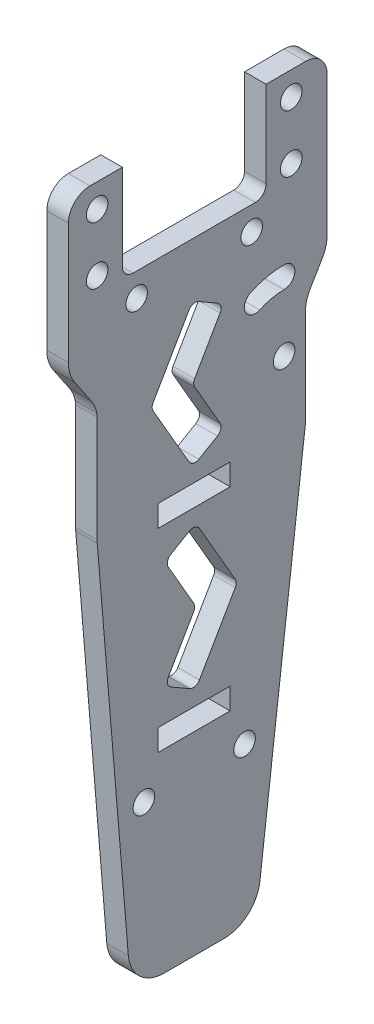
from build123d import *

# Parameters (mm, degrees)
SZKIC1_R                    = 1.5
DODANIE_WYCI_GNI_CIE1_DEPTH = 3
SZKIC9_R                    = 1.5
WYTNIJ_WYCI_GNI_CIE4_DEPTH  = 54.397097433
SZKIC6_W                    = 10
SZKIC6_H                    = 3
WYTNIJ_WYCI_GNI_CIE1_DEPTH  = 10
WYTNIJ_WYCI_GNI_CIE2_DEPTH  = 10
ZAOKR_GLENIE1_R             = 1
SZKIC8_R                    = 1.5
WYTNIJ_WYCI_GNI_CIE3_DEPTH  = 10


with BuildPart() as part:
    # Szkic1 → Dodanie-wyciągnięcie1 (new body)
    with BuildSketch(Plane(origin=(-2, 0, 0), x_dir=(0, -1, 0), z_dir=(-1, 0, 0))):
        with BuildLine():
            Line((-20.24459105, -15.5), (-6.872139727, -15.5))
            ThreePointArc((-6.872139727, -15.5), (-6.56909717, -15.490808072), (-6.26716883, -15.463266083))
            Line((-6.26716883, -15.463266083), (45.6049709, -9.140587762))
            ThreePointArc((45.6049709, -9.140587762), (48.743317679, -7.492072464), (50, -4.177321682))
            Line((50, -4.177321682), (50, 4.177321682))
            ThreePointArc((50, 4.177321682), (48.679496039, 7.562777175), (45.41547644, 9.16002971))
            Line((45.41547644, 9.16002971), (-6.425355197, 13.482708032))
            ThreePointArc((-6.425355197, 13.482708032), (-6.632913572, 13.495675138), (-6.840831633, 13.5))
            Line((-6.840831633, 13.5), (-21.632733572, 13.5))
            add(Edge.make_bspline(
                [(-22.133067045, 13.546725438), (-21.969989905, 13.515575146), (-21.803212082, 13.5), (-21.632733572, 13.5)],
                knots=[0, 0, 0, 0, 1, 1, 1, 1], degree=3))
            ThreePointArc((-22.133067045, 13.546725438), (-23.107973505, 13.838369968), (-24.00364259, 14.321356539))
            Line((-24.00364259, 14.321356539), (-27.413438343, 16.636574053))
            ThreePointArc((-27.413438343, 16.636574053), (-28.752925595, 17.279271402), (-30.222131118, 17.5))
            Line((-30.222131118, 17.5), (-47, 17.5))
            ThreePointArc((-47, 17.5), (-49.121320344, 16.621320344), (-50, 14.5))
            Line((-50, 14.5), (-50, 10.000000022))
            Line((-50, 10.000000022), (-38.00000001, 10.000000022))
            ThreePointArc((-38.00000001, 10.000000022), (-36.939339831, 9.560660191), (-36.5, 8.500000012))
            Line((-36.5, 8.500000012), (-36.5, -8.499999988))
            ThreePointArc((-36.5, -8.499999988), (-36.939339831, -9.560660167), (-38.00000001, -9.999999998))
            Line((-38.00000001, -9.999999998), (-50, -9.999999998))
            Line((-50, -9.999999998), (-50, -15.5))
            ThreePointArc((-50, -15.5), (-49.121320344, -17.621320344), (-47, -18.5))
            Line((-47, -18.5), (-27.642649228, -18.5))
            ThreePointArc((-27.642649228, -18.5), (-26.327062196, -18.323819105), (-25.104187684, -17.807692305))
            Line((-25.104187684, -17.807692305), (-22.282981034, -16.145195525))
            ThreePointArc((-22.282981034, -16.145195525), (-21.508740292, -15.774477313), (-20.682498739, -15.541656321))
            add(Edge.make_bspline(
                [(-20.24459105, -15.5), (-20.391122003, -15.5), (-20.537091233, -15.51388544), (-20.682498739, -15.541656321)],
                knots=[0, 0, 0, 0, 1, 1, 1, 1], degree=3))
        make_face()
        with Locations((-46.7, -13.5)):
            Circle(SZKIC1_R, mode=Mode.SUBTRACT)
        with Locations((-38.7, -13.5)):
            Circle(SZKIC1_R, mode=Mode.SUBTRACT)
        with Locations((-33.2, -8)):
            Circle(SZKIC1_R, mode=Mode.SUBTRACT)
        with Locations((-33.2, 8)):
            Circle(SZKIC1_R, mode=Mode.SUBTRACT)
        with Locations((-38.7, 13.5)):
            Circle(SZKIC1_R, mode=Mode.SUBTRACT)
        with Locations((-46.7, 13.5)):
            Circle(SZKIC1_R, mode=Mode.SUBTRACT)
    extrude(amount=-DODANIE_WYCI_GNI_CIE1_DEPTH)

    # Szkic9 → Wytnij-wyciągnięcie4 (cut, through all)
    with BuildSketch(Plane(origin=(1, 0, 0), x_dir=(0, 0, -1), z_dir=(1, 0, 0))):
        with Locations((12.5, 16)):
            Circle(SZKIC9_R)
        with BuildLine():
            ThreePointArc((12.5, 27), (10.119164247, 26.739256078), (7.851199121, 25.969385657))
            ThreePointArc((7.851199121, 25.969385657), (7.125664833, 23.975996584), (9.119053906, 23.250462296))
            ThreePointArc((9.119053906, 23.250462296), (10.768483088, 23.810368057), (12.5, 24))
            ThreePointArc((12.5, 24), (14, 25.5), (12.5, 27))
        make_face()
    extrude(amount=-WYTNIJ_WYCI_GNI_CIE4_DEPTH, mode=Mode.SUBTRACT)

    # Szkic6 → Wytnij-wyciągnięcie1 (cut)
    with BuildSketch(Plane(origin=(1, 0, 0), x_dir=(0, 0, -1), z_dir=(1, 0, 0))):
        with Locations((0, 5.5)):
            Rectangle(SZKIC6_W, SZKIC6_H)
        with Locations((0, -21.5)):
            Rectangle(SZKIC6_W, SZKIC6_H)
    extrude(amount=-WYTNIJ_WYCI_GNI_CIE1_DEPTH, mode=Mode.SUBTRACT)

    # Szkic7 → Wytnij-wyciągnięcie2 (cut)
    with BuildSketch(Plane(origin=(1, 0, 0), x_dir=(0, 0, -1), z_dir=(1, 0, 0))):
        Polygon((6, -8), (0.226497308, 2), (-4.103629711, -0.5), (0.226497308, -8), (-4.103629711, -15.5), (0.226497308, -18), align=None)
        Polygon((-6, 19), (-0.226497308, 9), (4.103629711, 11.5), (-0.226497308, 19), (4.103629711, 26.5), (-0.226497308, 29), align=None)
    extrude(amount=-WYTNIJ_WYCI_GNI_CIE2_DEPTH, mode=Mode.SUBTRACT)

    # Zaokrąglenie1
    zaokr_glenie1_edges = [part.edges().sort_by_distance(p)[0] for p in [
        (-0.5, -8, -6),
        (-0.5, -18, -0.226497308),
        (-0.5, -15.5, 4.103629711),
        (-0.5, -8, -0.226497308),
        (-0.5, -0.5, 4.103629711),
        (-0.5, 2, -0.226497308),
        (-0.5, 29, 0.226497308),
        (-0.5, 26.5, -4.103629711),
        (-0.5, 19, 0.226497308),
        (-0.5, 11.5, -4.103629711),
        (-0.5, 9, 0.226497308),
        (-0.5, 19, 6),
    ]]
    fillet(zaokr_glenie1_edges, radius=ZAOKR_GLENIE1_R)

    # Szkic8 → Wytnij-wyciągnięcie3 (cut)
    with BuildSketch(Plane.ZY.offset(2)):
        with Locations((7, -28)):
            Circle(SZKIC8_R)
        with Locations((-7, -28)):
            Circle(SZKIC8_R)
    extrude(amount=-WYTNIJ_WYCI_GNI_CIE3_DEPTH, mode=Mode.SUBTRACT)


solid = part.part
